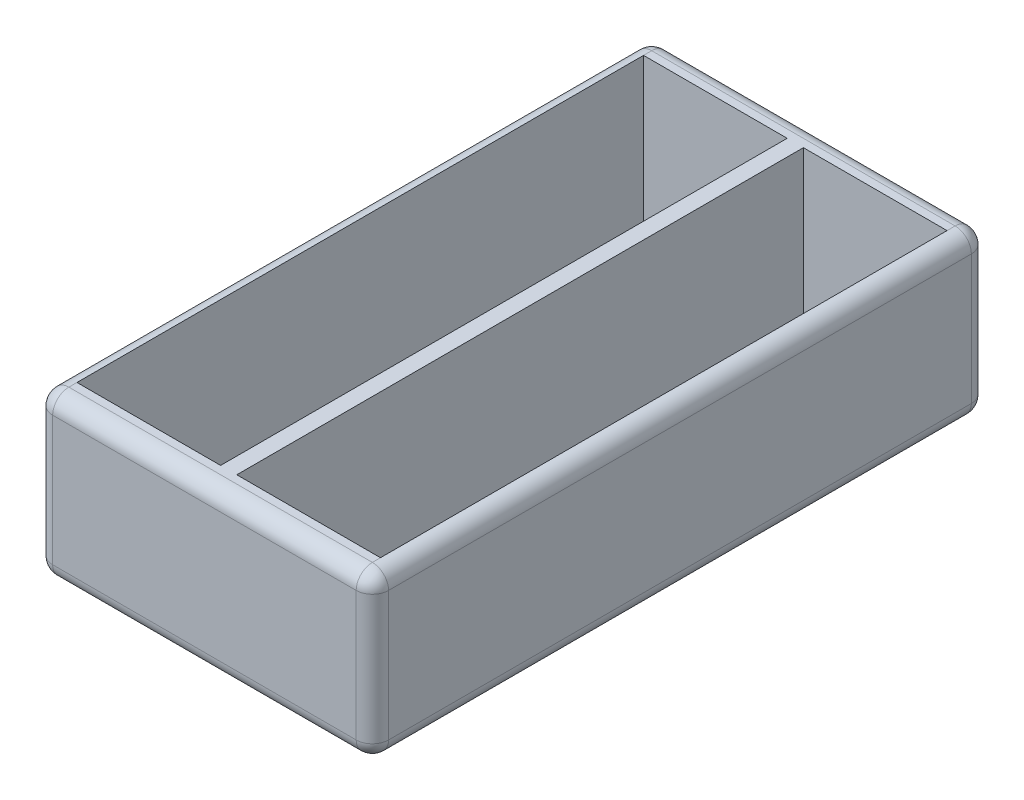
from build123d import *

# Parameters (mm, degrees)
SKETCH_1_W          = 41.5
SKETCH_1_H          = 76
EXTRUDE_1_DEPTH     = 20
SKETCH_2_W          = 17.75
SKETCH_2_H          = 70
CUT_EXTRUDE_1_DEPTH = 19
SKETCH_3_R          = 1.6
CUT_EXTRUDE_2_DEPTH = 19
FILLET_1_R          = 2


with BuildPart() as part:
    # 草图1 → 凸台-拉伸1 (new body)
    with BuildSketch(Plane(origin=(0, 0, 0), x_dir=(1, 0, 0), z_dir=(0, 1, 0))):
        Rectangle(SKETCH_1_W, SKETCH_1_H)
    extrude(amount=EXTRUDE_1_DEPTH)

    # 草图2 → 切除-拉伸1 (cut)
    with BuildSketch(Plane(origin=(0, 20, 0), x_dir=(1, 0, 0), z_dir=(0, 1, 0))):
        with Locations((-9.875, 0)):
            Rectangle(SKETCH_2_W, SKETCH_2_H)
        with Locations((9.875, 0)):
            Rectangle(SKETCH_2_W, SKETCH_2_H)
    extrude(amount=-CUT_EXTRUDE_1_DEPTH, mode=Mode.SUBTRACT)

    # 草图3 → 切除-拉伸2 (cut)
    with BuildSketch(Plane(origin=(0, 1, 0), x_dir=(1, 0, 0), z_dir=(0, 1, 0))):
        with Locations(Location((-8.85, 0, 0), (0, 0, 270))):
            Circle(SKETCH_3_R)
        with Locations(Location((8.85, 0, 0), (0, 0, 90))):
            Circle(SKETCH_3_R)
    extrude(amount=-CUT_EXTRUDE_2_DEPTH, mode=Mode.SUBTRACT)

    # 圆角1
    fillet_1_edges = [part.edges().sort_by_distance(p)[0] for p in [
        (-20.75, 20, 0),
        (0, 20, 38),
        (20.75, 20, 0),
        (0, 0, 38),
        (-20.75, 0, 0),
        (0, 0, -38),
        (20.75, 0, 0),
        (20.75, 10, 38),
        (-20.75, 10, 38),
        (-20.75, 10, -38),
        (20.75, 10, -38),
        (0, 20, -38),
    ]]
    fillet(fillet_1_edges, radius=FILLET_1_R - 0.0001)  # a hair under: the kernel refuses the full size


solid = part.part
